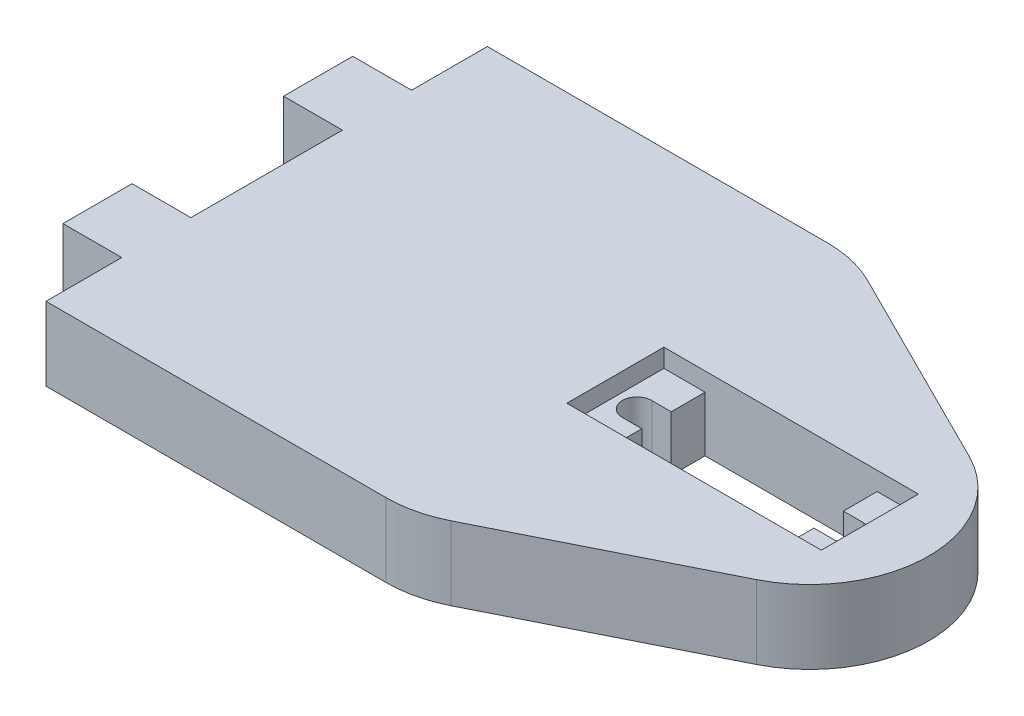
from build123d import *

# Parameters (mm, degrees)
BOSS_EXTRUDE2_DEPTH = 10
CUT_EXTRUDE2_DEPTH  = 10
FILLET3_R           = 16
SKETCH6_W           = 23.4
SKETCH6_H           = 13.2
CUT_EXTRUDE3_DEPTH  = 10
CUT_EXTRUDE4_DEPTH  = 10
SKETCH8_W           = 8
SKETCH8_H           = 0.3
CUT_EXTRUDE5_DEPTH  = 10
SKETCH10_W          = 34.6
SKETCH10_H          = 13.2
CUT_EXTRUDE6_DEPTH  = 2.5


with BuildPart() as part:
    # Sketch1 → Boss-Extrude2 (new body)
    with BuildSketch(Plane(origin=(0, 0, 0), x_dir=(1, 0, 0), z_dir=(0, 1, 0))):
        Polygon((0, 0), (0, 10), (-8, 10), (-8, 20), (0, 20), (0, 40), (-8, 40), (-8, 50), (0, 50), (0, 60), (50, 60), (90, 40), (90, 20), (50, 0), align=None)
    extrude(amount=BOSS_EXTRUDE2_DEPTH)

    # Sketch5 → Cut-Extrude2 (cut)
    with BuildSketch(Plane(origin=(0, 10, 0), x_dir=(1, 0, 0), z_dir=(0, 1, 0))):
        with BuildLine():
            Line((90, 20), (90, 30))
            ThreePointArc((90, 30), (87.583479317, 21.493491916), (81.05572809, 15.527864045))
            Line((81.05572809, 15.527864045), (90, 20))
        make_face()
        with BuildLine():
            Line((90, 40), (81.05572809, 44.472135955))
            ThreePointArc((81.05572809, 44.472135955), (87.583479317, 38.506508084), (90, 30))
            Line((90, 30), (90, 40))
        make_face()
    extrude(amount=-CUT_EXTRUDE2_DEPTH, mode=Mode.SUBTRACT)

    # Fillet3
    fillet3_edges = [part.edges().sort_by_distance(p)[0] for p in [
        (50, 5, -60),
        (50, 5, 0),
    ]]
    fillet(fillet3_edges, radius=FILLET3_R)

    # Sketch6 → Cut-Extrude3 (cut)
    with BuildSketch(Plane(origin=(0, 10, 0), x_dir=(1, 0, 0), z_dir=(0, 1, 0))):
        with Locations((64.7, 30)):
            Rectangle(SKETCH6_W, SKETCH6_H)
    extrude(amount=-CUT_EXTRUDE3_DEPTH, mode=Mode.SUBTRACT)

    # Sketch7 → Cut-Extrude4 (cut)
    with BuildSketch(Plane(origin=(0, 10, 0), x_dir=(1, 0, 0), z_dir=(0, 1, 0))):
        with BuildLine():
            Line((79.05, 32), (76.4, 32))
            Line((76.4, 32), (76.4, 28))
            Line((76.4, 28), (79.05, 28))
            ThreePointArc((79.05, 28), (81.05, 30), (79.05, 32))
        make_face()
        with BuildLine():
            Line((53, 32), (53, 28))
            Line((53, 28), (50.35, 28))
            ThreePointArc((50.35, 28), (48.35, 30), (50.35, 32))
            Line((50.35, 32), (53, 32))
        make_face()
    extrude(amount=-CUT_EXTRUDE4_DEPTH, mode=Mode.SUBTRACT)

    # Sketch8 → Cut-Extrude5 (cut)
    with BuildSketch(Plane(origin=(0, 10, 0), x_dir=(1, 0, 0), z_dir=(0, 1, 0))):
        with Locations((-4, 49.85)):
            Rectangle(SKETCH8_W, SKETCH8_H)
        with Locations((-4, 40.15)):
            Rectangle(SKETCH8_W, SKETCH8_H)
        with Locations((-4, 19.85)):
            Rectangle(SKETCH8_W, SKETCH8_H)
        with Locations((-4, 10.15)):
            Rectangle(SKETCH8_W, SKETCH8_H)
    extrude(amount=-CUT_EXTRUDE5_DEPTH, mode=Mode.SUBTRACT)

    # Sketch10 → Cut-Extrude6 (cut)
    with BuildSketch(Plane(origin=(0, 10, 0), x_dir=(1, 0, 0), z_dir=(0, 1, 0))):
        with Locations((64.7, 30)):
            Rectangle(SKETCH10_W, SKETCH10_H)
    extrude(amount=-CUT_EXTRUDE6_DEPTH, mode=Mode.SUBTRACT)


solid = part.part
